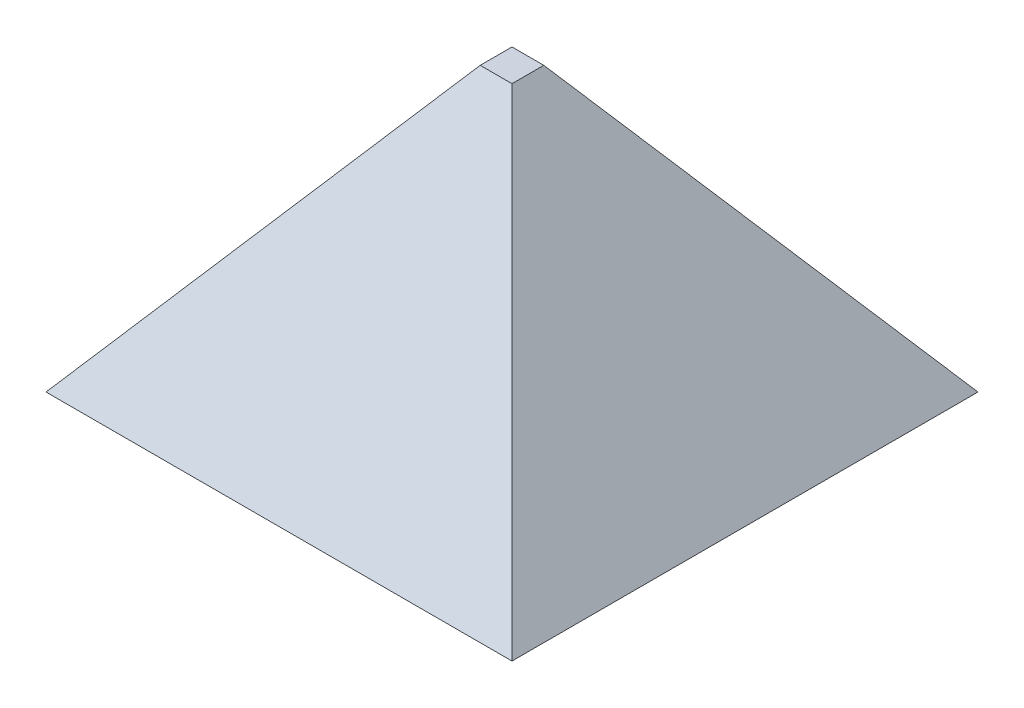
from build123d import *

# Parameters (mm, degrees)
SKETCH1_W           = 28
SKETCH1_H           = 28
BOSS_EXTRUDE1_DEPTH = 17
BOSS_EXTRUDE1_TAPER = 37.5


with BuildPart() as part:
    # Sketch1 → Boss-Extrude1 (new body)
    with BuildSketch(Plane(origin=(0, 0, 0), x_dir=(1, 0, 0), z_dir=(0, 1, 0))):
        Rectangle(SKETCH1_W, SKETCH1_H)
    extrude(amount=BOSS_EXTRUDE1_DEPTH, taper=BOSS_EXTRUDE1_TAPER)


solid = part.part
